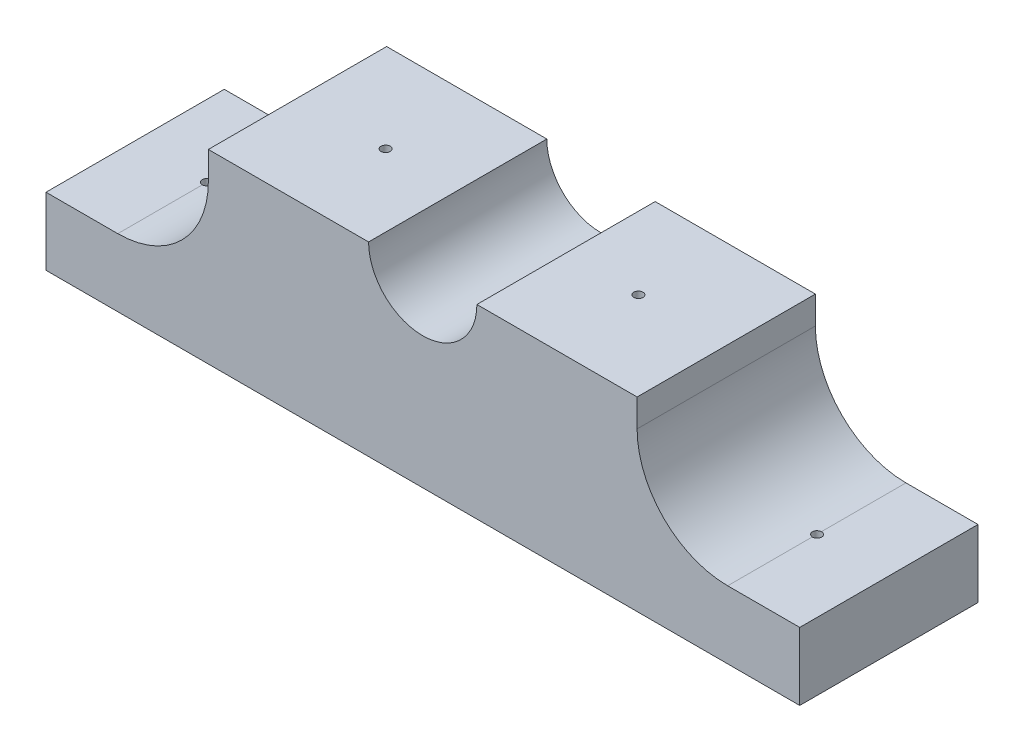
from build123d import *

# Parameters (mm, degrees)
SKETCH2_W               = 41.746000074
SKETCH2_H               = 9.873000066
BOSS_EXTRUDE1_DEPTH     = 3.746000128
SKETCH3_W               = 23.746000006
SKETCH3_H               = 9.873000066
BOSS_EXTRUDE2_DEPTH     = 6.548499984
FILLET1_R               = 5.0165
SKETCH4_R               = 2.99974
CUT_EXTRUDE1_DEPTH      = 26.281119307
CUT_EXTRUDE2_DEPTH      = 23.426190384
CUT_EXTRUDE2_DEPTH_BACK = 2.54
SKETCH6_R               = 0.254
SKETCH7_R               = 0.254
CUT_EXTRUDE3_DEPTH      = 2.54


with BuildPart() as part:
    # Sketch2 → Boss-Extrude1 (new body)
    with BuildSketch(Plane(origin=(0, 0, 0), x_dir=(1, 0, 0), z_dir=(0, 1, 0))):
        Rectangle(SKETCH2_W, SKETCH2_H)
    extrude(amount=BOSS_EXTRUDE1_DEPTH)

    # Sketch3 → Boss-Extrude2 (add)
    with BuildSketch(Plane(origin=(0, 3.746000128, 0), x_dir=(1, 0, 0), z_dir=(0, 1, 0))):
        with Locations((-0.00733485, 0)):
            Rectangle(SKETCH3_W, SKETCH3_H)
    extrude(amount=BOSS_EXTRUDE2_DEPTH)

    # Fillet1
    fillet1_edges = [part.edges().sort_by_distance(p)[0] for p in [
        (11.865665153, 3.746000128, 0),
        (-11.880334853, 3.746000128, 0),
    ]]
    fillet(fillet1_edges, radius=FILLET1_R)

    # Sketch4 → Cut-Extrude1 (cut, through all)
    with BuildSketch(Plane.XY.offset(4.936500033)):
        with Locations((-0.00733485, 10.294500112)):
            Circle(SKETCH4_R)
    extrude(amount=-CUT_EXTRUDE1_DEPTH, mode=Mode.SUBTRACT)

    # Sketch6 → Cut-Extrude2 (cut, two sides: drawn at the far end of the back side and taken through both)
    with BuildSketch(Plane(origin=(0, 3.746000128, 0), x_dir=(1, 0, 0), z_dir=(0, 1, 0)).offset(-CUT_EXTRUDE2_DEPTH_BACK)):
        with Locations((-16.896834853, 0)):
            Circle(SKETCH6_R)
        with Locations((16.896834853, 0)):
            Circle(SKETCH6_R)
    extrude(amount=CUT_EXTRUDE2_DEPTH + CUT_EXTRUDE2_DEPTH_BACK, mode=Mode.SUBTRACT)

    # Sketch7 → Cut-Extrude3 (cut)
    with BuildSketch(Plane(origin=(0, 10.294500112, 0), x_dir=(1, 0, 0), z_dir=(0, 1, 0))):
        with Locations((-6.99999997, 0)):
            Circle(SKETCH7_R)
        with Locations((6.99999997, 0)):
            Circle(SKETCH7_R)
    extrude(amount=-CUT_EXTRUDE3_DEPTH, mode=Mode.SUBTRACT)


solid = part.part
